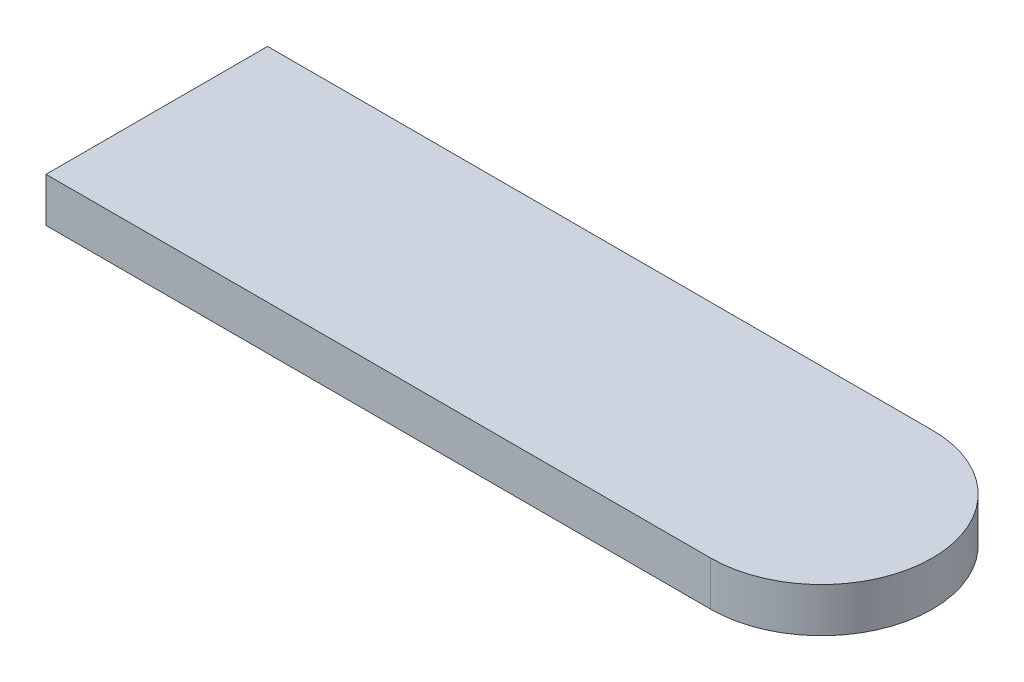
from build123d import *

# Parameters (mm, degrees)
BOSS_EXTRU_1_DEPTH = 10


with BuildPart() as part:
    # Esquisse1 → Boss.-Extru.1 (new body)
    with BuildSketch(Plane(origin=(0, 0, 0), x_dir=(1, 0, 0), z_dir=(0, 1, 0))):
        with BuildLine():
            Line((-87.5, 25), (-87.5, -25))
            Line((-87.5, -25), (62.5, -25))
            ThreePointArc((62.5, -25), (87.5, 0), (62.5, 25))
            Line((62.5, 25), (-87.5, 25))
        make_face()
    extrude(amount=BOSS_EXTRU_1_DEPTH)


solid = part.part
